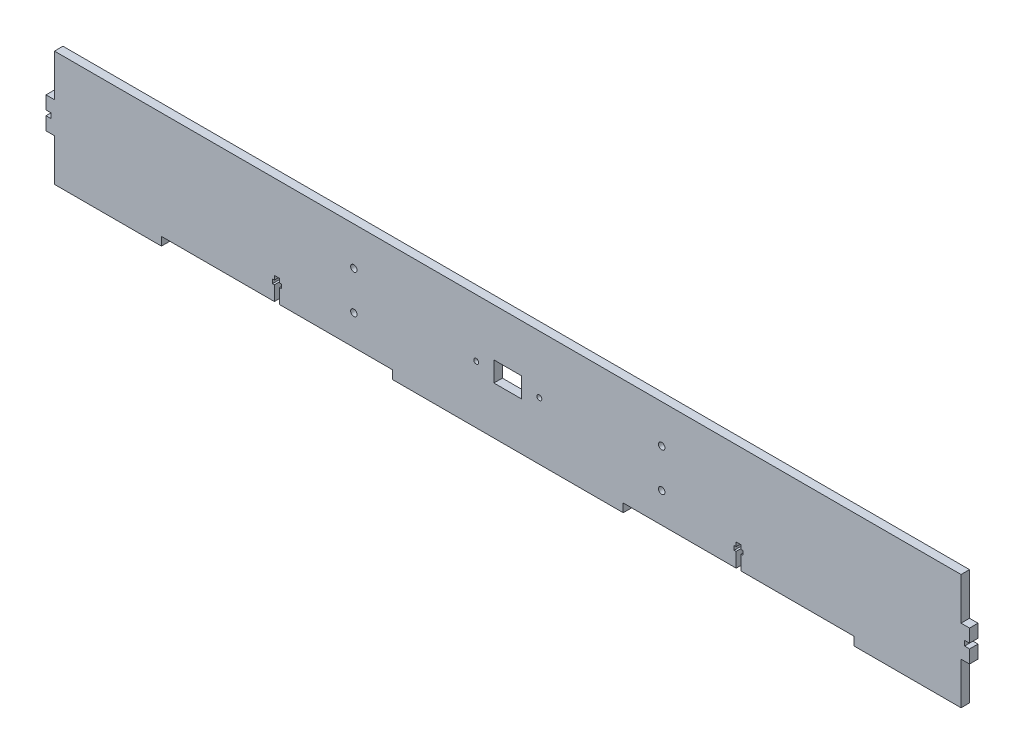
from build123d import *

# Parameters (mm, degrees)
BOSS_EXTRUDE1_DEPTH     = 5.5
CUT_EXTRUDE1_DEPTH      = 907.379197687
CUT_EXTRUDE1_DEPTH_BACK = 907.379197687
SKETCH2_R               = 1.6
SKETCH2_W               = 18
SKETCH2_H               = 13
SKETCH3_R               = 2.1
CUT_EXTRUDE2_DEPTH      = 907.379197687


with BuildPart() as part:
    # Sketch1 → Boss-Extrude1 (new body)
    with BuildSketch(Plane.XY):
        Polygon((308.5, 78), (308.5, 50.625), (303, 50.625), (303, 42.125), (306.25, 42.125), (306.25, 40.5), (306.25, 38.875), (303, 38.875), (303, 30.375), (308.5, 30.375), (308.5, 3), (378, 3), (378, 8.5), (451.375, 8.5), (451.375, 17.95), (450.125, 17.95), (450.125, 20.6), (451.375, 20.6), (451.375, 23.25), (454.625, 23.25), (454.625, 20.6), (455.875, 20.6), (455.875, 17.95), (454.625, 17.95), (454.625, 8.5), (528, 8.5), (528, 3), (678, 3), (678, 8.5), (751.375, 8.5), (751.375, 17.95), (750.125, 17.95), (750.125, 20.6), (751.375, 20.6), (751.375, 23.25), (754.625, 23.25), (754.625, 20.6), (755.875, 20.6), (755.875, 17.95), (754.625, 17.95), (754.625, 8.5), (828, 8.5), (828, 3), (897.5, 3), (897.5, 30.375), (903, 30.375), (903, 38.875), (899.75, 38.875), (899.75, 40.5), (899.75, 42.125), (903, 42.125), (903, 50.625), (897.5, 50.625), (897.5, 78), align=None)
    extrude(amount=BOSS_EXTRUDE1_DEPTH)

    # Sketch2 → Cut-Extrude1 (cut, two sides: drawn at the far end of the back side and taken through both)
    with BuildSketch(Plane.XY.offset(5.5).offset(-CUT_EXTRUDE1_DEPTH_BACK)):
        with Locations((623.5, 40.5)):
            Circle(SKETCH2_R)
        with Locations((603, 40.5)):
            Rectangle(SKETCH2_W, SKETCH2_H)
        with Locations((582.5, 40.5)):
            Circle(SKETCH2_R)
    extrude(amount=CUT_EXTRUDE1_DEPTH + CUT_EXTRUDE1_DEPTH_BACK, mode=Mode.SUBTRACT)

    # Sketch3 → Cut-Extrude2 (cut, through all)
    with BuildSketch(Plane.XY.offset(5.5)):
        with Locations((503, 53)):
            Circle(SKETCH3_R)
        with Locations((503, 28)):
            Circle(SKETCH3_R)
        with Locations((703, 28)):
            Circle(SKETCH3_R)
        with Locations((703, 53)):
            Circle(SKETCH3_R)
    extrude(amount=-CUT_EXTRUDE2_DEPTH, mode=Mode.SUBTRACT)


solid = part.part
